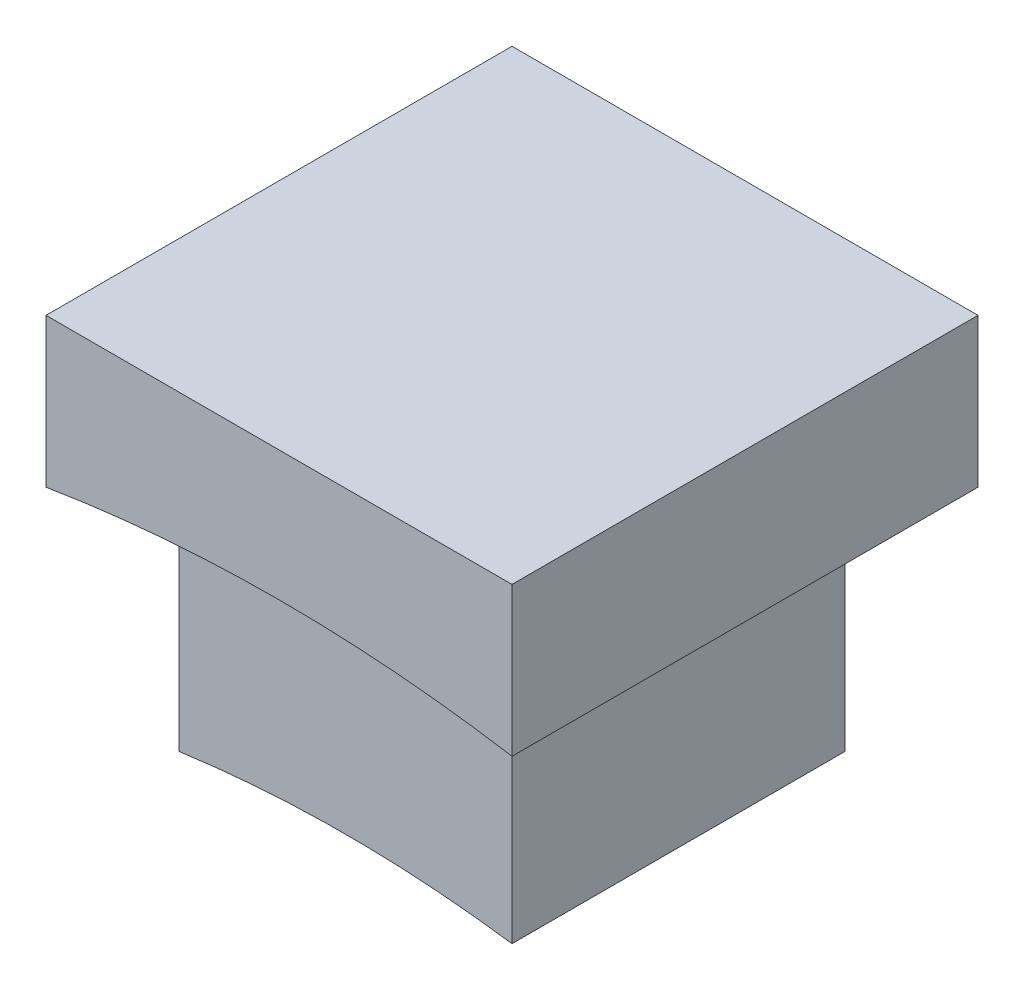
from build123d import *

# Parameters (mm, degrees)
SKETCH1_W               = 14
SKETCH1_H               = 14
BOSS_EXTRUDE1_DEPTH     = 10
CUT_EXTRUDE1_DEPTH      = 15.071247279
CUT_EXTRUDE1_DEPTH_BACK = 15.071247279
SKETCH2_R               = 43.1
SKETCH3_W               = 10
SKETCH3_H               = 10
BOSS_EXTRUDE2_DEPTH     = 15
CUT_EXTRUDE2_DEPTH      = 15.071247279
CUT_EXTRUDE2_DEPTH_BACK = 15.071247279
SKETCH5_R               = 36


with BuildPart() as part:
    # Sketch1 → Boss-Extrude1 (new body)
    with BuildSketch(Plane(origin=(0, 0, 0), x_dir=(1, 0, 0), z_dir=(0, 1, 0))):
        Rectangle(SKETCH1_W, SKETCH1_H)
    extrude(amount=BOSS_EXTRUDE1_DEPTH)

    # Sketch2 → Cut-Extrude1 (cut, two sides: drawn at the far end of the back side and taken through both)
    with BuildSketch(Plane.XY.offset(-CUT_EXTRUDE1_DEPTH_BACK)):
        with Locations((0, -37)):
            Circle(SKETCH2_R)
    extrude(amount=CUT_EXTRUDE1_DEPTH + CUT_EXTRUDE1_DEPTH_BACK, mode=Mode.SUBTRACT)

    # Sketch3 → Boss-Extrude2 (add)
    with BuildSketch(Plane(origin=(0, 10, 0), x_dir=(1, 0, 0), z_dir=(0, 1, 0))):
        Rectangle(SKETCH3_W, SKETCH3_H)
    extrude(amount=-BOSS_EXTRUDE2_DEPTH)

    # Sketch5 → Cut-Extrude2 (cut, two sides: drawn at the far end of the back side and taken through both)
    with BuildSketch(Plane.XY.offset(-CUT_EXTRUDE2_DEPTH_BACK)):
        with Locations((0, -37)):
            Circle(SKETCH5_R)
    extrude(amount=CUT_EXTRUDE2_DEPTH + CUT_EXTRUDE2_DEPTH_BACK, mode=Mode.SUBTRACT)


solid = part.part
